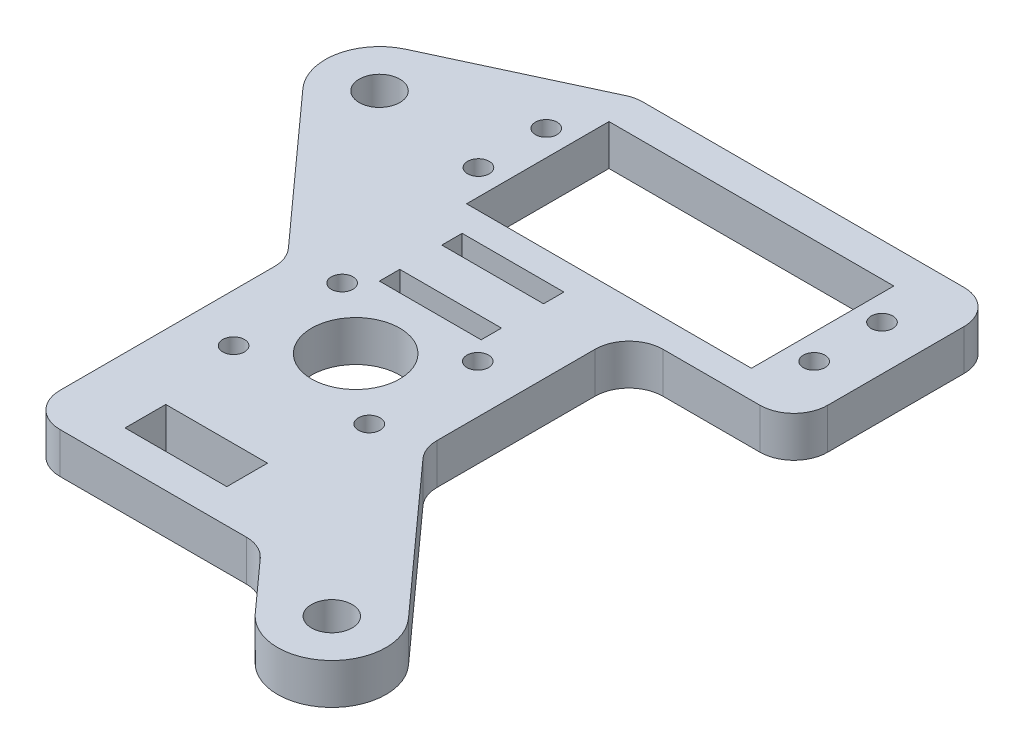
from build123d import *

# Parameters (mm, degrees)
ESBO_O1_R                = 6.5
ESBO_O1_R_2              = 1.6
ESBO_O1_R_3              = 3
ESBO_O1_W                = 15
ESBO_O1_H                = 3
ESBO_O1_H_2              = 6
ESBO_O1_W_2              = 42
ESBO_O1_H_3              = 21
RESSALTO_EXTRUS_O1_DEPTH = 6


with BuildPart() as part:
    # Esboço1 → Ressalto-extrusão1 (new body)
    with BuildSketch(Plane.XZ.offset(6)):
        with BuildLine():
            Line((30.793557575, -136.55366306), (52.89462836, -146.829127406))
            ThreePointArc((52.89462836, -146.829127406), (53.923154275, -147.177291613), (55.00259, -147.2952))
            Line((55.00259, -147.2952), (102.35259, -147.2952))
            ThreePointArc((102.35259, -147.2952), (105.888123906, -145.830733906), (107.35259, -142.2952))
            Line((107.35259, -142.2952), (107.35259, -122.2))
            ThreePointArc((107.35259, -122.2), (105.888123906, -118.664466094), (102.35259, -117.2))
            Line((102.35259, -117.2), (88.05, -117.2))
            ThreePointArc((88.05, -117.2), (84.514466094, -115.735533906), (83.05, -112.2))
            Line((83.05, -112.2), (83.05, -88.883658571))
            ThreePointArc((83.05, -88.883658571), (83.382097868, -87.091818823), (84.334275873, -85.538005539))
            Line((84.334275873, -85.538005539), (103.678862406, -64.053665641))
            ThreePointArc((103.678862406, -64.053665641), (103.086748653, -52.755462186), (91.788545198, -53.347575939))
            Line((91.788545198, -53.347575939), (85.037246259, -60.845653032))
            ThreePointArc((85.037246259, -60.845653032), (83.355205347, -62.067727288), (81.321522132, -62.5))
            Line((81.321522132, -62.5), (53.85, -62.5))
            ThreePointArc((53.85, -62.5), (50.314466094, -63.964466094), (48.85, -67.5))
            Line((48.85, -67.5), (48.85, -99.116341429))
            ThreePointArc((48.85, -99.116341429), (48.517902132, -100.908181177), (47.565724127, -102.461994461))
            Line((47.565724127, -102.461994461), (28.221137594, -123.946334359))
            ThreePointArc((28.221137594, -123.946334359), (26.32780231, -130.898758331), (30.793557575, -136.55366306))
        make_face()
        with Locations((65.95, -94)):
            Circle(ESBO_O1_R, mode=Mode.SUBTRACT)
        with Locations((55.95, -102)):
            Circle(ESBO_O1_R_2, mode=Mode.SUBTRACT)
        with Locations((55.95, -86)):
            Circle(ESBO_O1_R_2, mode=Mode.SUBTRACT)
        with Locations((75.95, -102)):
            Circle(ESBO_O1_R_2, mode=Mode.SUBTRACT)
        with Locations((75.95, -86)):
            Circle(ESBO_O1_R_2, mode=Mode.SUBTRACT)
        with Locations((100.75259, -126.7952)):
            Circle(ESBO_O1_R_2, mode=Mode.SUBTRACT)
        with Locations((100.75259, -136.7952)):
            Circle(ESBO_O1_R_2, mode=Mode.SUBTRACT)
        with Locations((51.25259, -126.7952)):
            Circle(ESBO_O1_R_2, mode=Mode.SUBTRACT)
        with Locations((51.25259, -136.7952)):
            Circle(ESBO_O1_R_2, mode=Mode.SUBTRACT)
        with Locations((34.166296198, -129.29937921)):
            Circle(ESBO_O1_R_3, mode=Mode.SUBTRACT)
        with Locations((97.733703802, -58.70062079)):
            Circle(ESBO_O1_R_3, mode=Mode.SUBTRACT)
        with Locations((65.95, -115.7)):
            Rectangle(ESBO_O1_W, ESBO_O1_H, mode=Mode.SUBTRACT)
        with Locations((65.95, -106.5)):
            Rectangle(ESBO_O1_W, ESBO_O1_H, mode=Mode.SUBTRACT)
        with Locations((65.95, -70.5)):
            Rectangle(ESBO_O1_W, ESBO_O1_H_2, mode=Mode.SUBTRACT)
        with Locations((76.00259, -131.7952)):
            Rectangle(ESBO_O1_W_2, ESBO_O1_H_3, mode=Mode.SUBTRACT)
    extrude(amount=-RESSALTO_EXTRUS_O1_DEPTH)


solid = part.part
